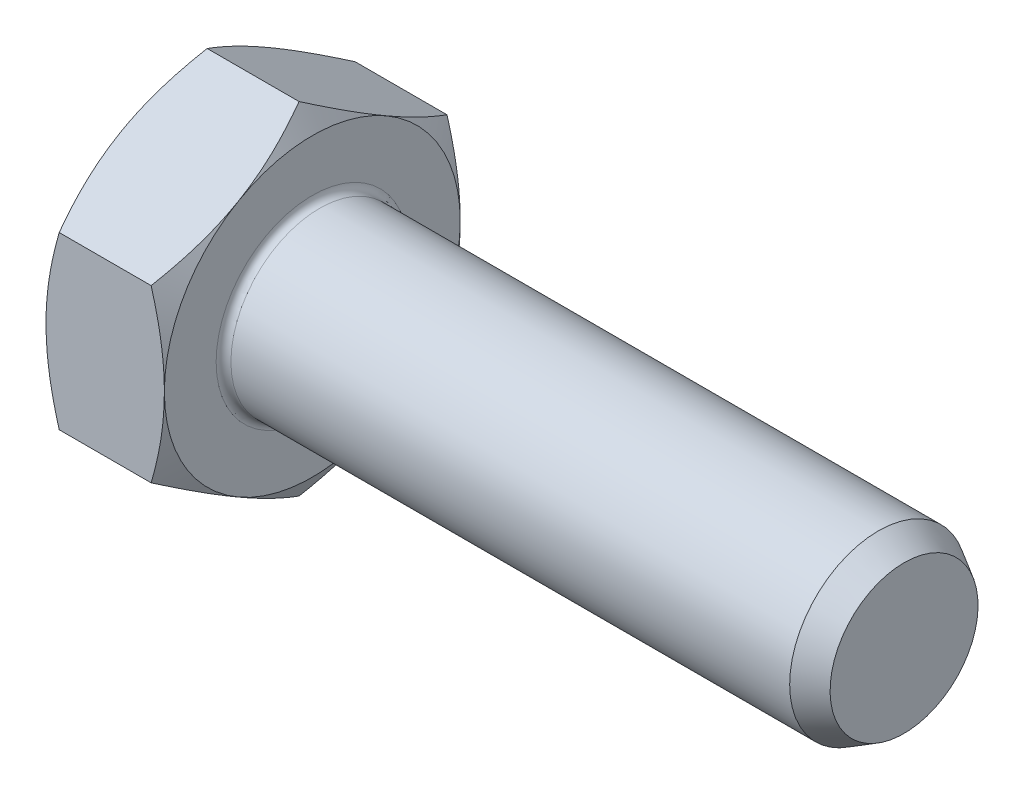
from build123d import *

# Parameters (mm, degrees)
BASEHEAD_DEPTH = 4
SKETCH1_W      = 20
SKETCH1_H      = 3
FILLET2_R      = 0.25
SKETCH6_W      = 0.8
SKETCH6_H      = 4.166666667


with BuildPart() as part:
    # Sketch2 → BaseHead (new body)
    with BuildSketch(Plane(origin=(0, 0, 0), x_dir=(0, 0, -1), z_dir=(1, 0, 0))):
        Polygon((0, 5.773502692), (-5, 2.886751346), (-5, -2.886751346), (0, -5.773502692), (5, -2.886751346), (5, 2.886751346), align=None)
    extrude(amount=BASEHEAD_DEPTH)

    # Sketch1 → BaseBody (revolve)
    with BuildSketch(Plane.XY):
        with Locations((14, 1.5)):
            Rectangle(SKETCH1_W, SKETCH1_H)
    revolve(axis=Axis((-14.105406183, 0, 0), (1, 0, 0)))

    # Fillet2
    fillet2_edges = [part.edges().sort_by_distance(p)[0] for p in [
        (4, -3, 0),
    ]]
    fillet(fillet2_edges, radius=FILLET2_R)

    # Sketch3 → Cut-Revolve3 (revolve, cut)
    with BuildSketch(Plane.XY):
        Polygon((0, 5.773502692), (0.446581987, 5.773502692), (0, 5), align=None)
        Polygon((4, 5), (4, 5.773502692), (3.553418013, 5.773502692), align=None)
    revolve(axis=Axis((4.411893243, 0, 0), (1, 0, 0)), mode=Mode.SUBTRACT)

    # Sketch4 → Cut-Revolve1 (revolve, cut)
    with BuildSketch(Plane.XY):
        Polygon((23.133974596, -3), (24, -2.5), (24, -3), align=None)
    revolve(axis=Axis((25.328193536, 0, 0), (-1, 0, 0)), mode=Mode.SUBTRACT)

    # Sketch6 → Cut-Revolve4 (revolve, cut)
    with BuildSketch(Plane.XY):
        with Locations((0.4, 2.083333334)):
            Rectangle(SKETCH6_W, SKETCH6_H)
    revolve(axis=Axis((0, 0, 0), (1, 0, 0)), mode=Mode.SUBTRACT)


solid = part.part
